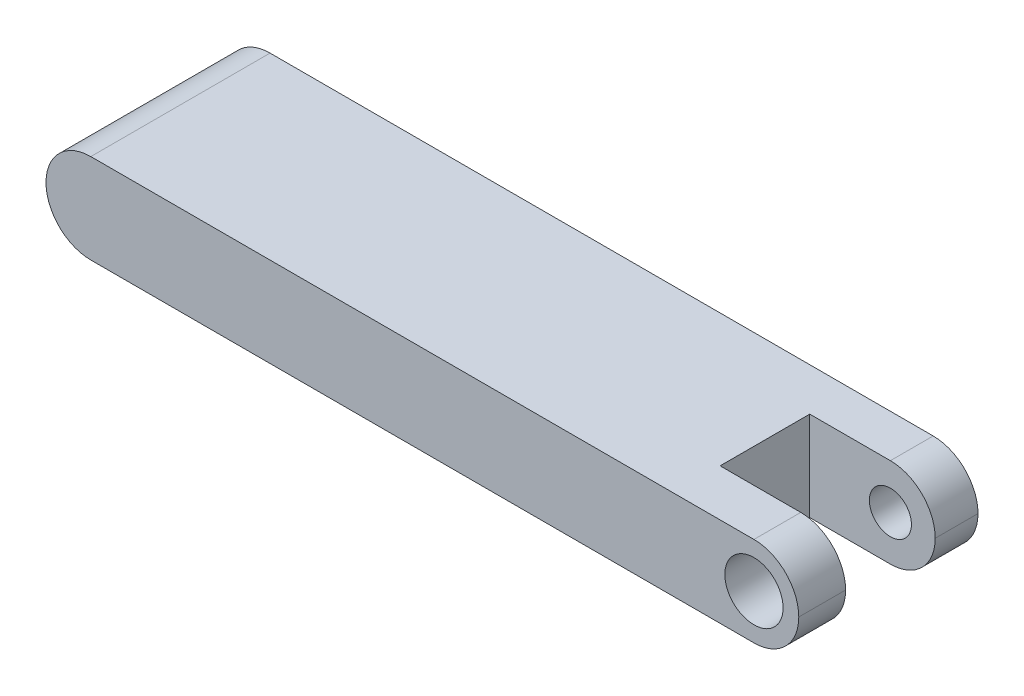
from build123d import *

# Parameters (mm, degrees)
SKETCH1_W                        = 21.336
SKETCH1_H                        = 5.08
BOSS_EXTRUDE1_DEPTH              = 2.54
FILLET1_R                        = 1.27
SKETCH8_W                        = 3.556
SKETCH8_H                        = 2.54
CUT_EXTRUDE1_DEPTH               = 2.54
F_97_0_0059_DIAMETER_HOLE1_D     = 1.651
F_97_0_0059_DIAMETER_HOLE1_DEPTH = 1.524
F_97_0_0059_DIAMETER_HOLE1_TIP   = 0.496010441
F_0_80_TAPPED_HOLE1_D            = 1.19126
F_0_80_TAPPED_HOLE1_DEPTH        = 4.064
F_0_80_TAPPED_HOLE1_TIP          = 0.357890611


with BuildPart() as part:
    # Sketch1 → Boss-Extrude1 (new body)
    with BuildSketch(Plane(origin=(0, 0, 0), x_dir=(1, 0, 0), z_dir=(0, 1, 0))):
        with Locations((1.778, 2.54)):
            Rectangle(SKETCH1_W, SKETCH1_H)
    extrude(amount=BOSS_EXTRUDE1_DEPTH)

    # Fillet1
    fillet1_edges = [part.edges().sort_by_distance(p)[0] for p in [
        (-8.89, 0, -2.54),
        (-8.89, 2.54, -2.54),
        (12.446, 0, -2.54),
        (12.446, 2.54, -2.54),
    ]]
    fillet(fillet1_edges, radius=FILLET1_R - 0.0001)  # a hair under: the kernel refuses the full size

    # Sketch8 → Cut-Extrude1 (cut)
    with BuildSketch(Plane(origin=(0, 2.54, 0), x_dir=(1, 0, 0), z_dir=(0, 1, 0))):
        with Locations((10.668, 2.596814381)):
            Rectangle(SKETCH8_W, SKETCH8_H)
    extrude(amount=-CUT_EXTRUDE1_DEPTH, mode=Mode.SUBTRACT)

    # #97 (0.0059) Diameter Hole1
    with Locations(Plane.XY):
        with Locations((11.176, 1.27)):
            Hole(F_97_0_0059_DIAMETER_HOLE1_D / 2, depth=F_97_0_0059_DIAMETER_HOLE1_DEPTH)
            with Locations((0, 0, -(F_97_0_0059_DIAMETER_HOLE1_DEPTH + F_97_0_0059_DIAMETER_HOLE1_TIP / 2))):  # 118° drill point
                Cone(0, F_97_0_0059_DIAMETER_HOLE1_D / 2, F_97_0_0059_DIAMETER_HOLE1_TIP, mode=Mode.SUBTRACT)

    # #0-80 Tapped Hole1
    with Locations(Plane.XY.offset(-3.866814381)):
        with Locations((11.176, 1.27)):
            Hole(F_0_80_TAPPED_HOLE1_D / 2, depth=F_0_80_TAPPED_HOLE1_DEPTH)
            with Locations((0, 0, -(F_0_80_TAPPED_HOLE1_DEPTH + F_0_80_TAPPED_HOLE1_TIP / 2))):  # 118° drill point
                Cone(0, F_0_80_TAPPED_HOLE1_D / 2, F_0_80_TAPPED_HOLE1_TIP, mode=Mode.SUBTRACT)


solid = part.part
